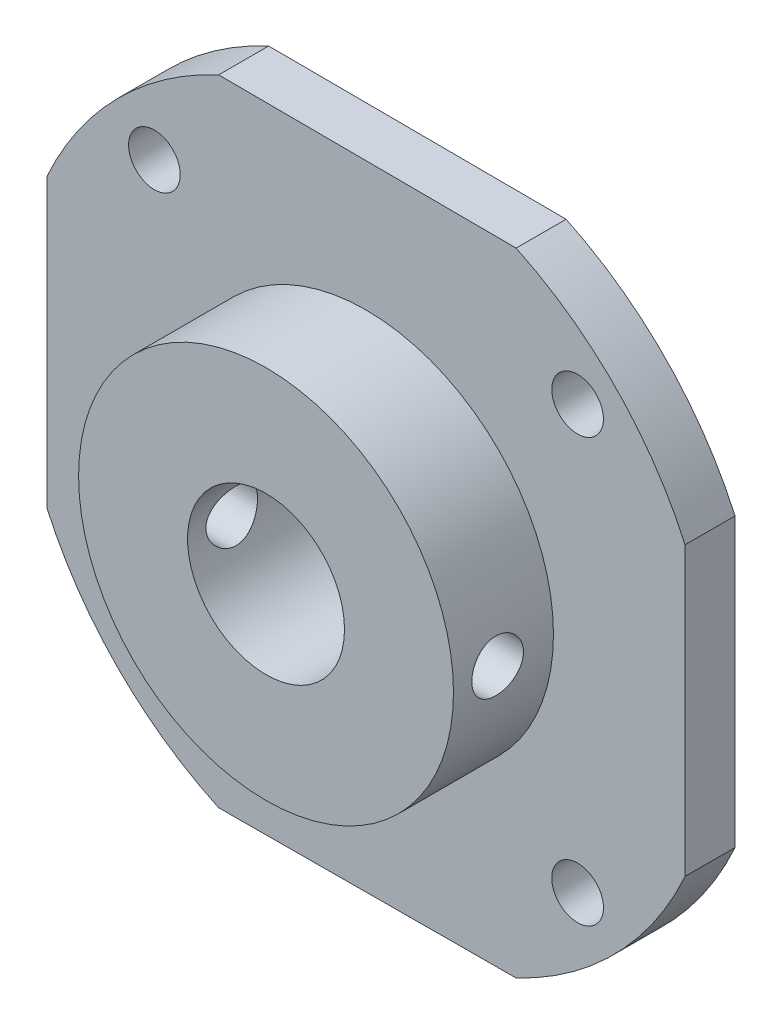
from build123d import *

# Parameters (mm, degrees)
SKETCH1_R          = 21
EXTRUDE1_DEPTH     = 3
SKETCH2_R          = 11.25
EXTRUDE2_DEPTH     = 6
SKETCH3_R          = 1.55
CUT_EXTRUDE1_DEPTH = 44.45
SKETCH4_R          = 1.55
CUT_EXTRUDE2_DEPTH = 62.423132867
SKETCH5_R          = 4.71
CUT_EXTRUDE3_DEPTH = 62.788358531
CUT_EXTRUDE7_DEPTH = 62.788358546


with BuildPart() as part:
    # Sketch1 → Extrude1 (new body)
    with BuildSketch(Plane.XY):
        with Locations((22.225, 22.225)):
            Circle(SKETCH1_R)
    extrude(amount=EXTRUDE1_DEPTH)

    # Sketch2 → Extrude2 (add)
    with BuildSketch(Plane.XY.offset(3)):
        with Locations((22.225, 22.225)):
            Circle(SKETCH2_R)
    extrude(amount=EXTRUDE2_DEPTH)

    # Sketch3 → Cut-Extrude1 (cut)
    with BuildSketch(Plane(origin=(0, 0, 0), x_dir=(0, 0, -1), z_dir=(1, 0, 0))):
        with Locations((-6.35, 22.225)):
            Circle(SKETCH3_R)
    extrude(amount=CUT_EXTRUDE1_DEPTH, mode=Mode.SUBTRACT)

    # Sketch4 → Cut-Extrude2 (cut, through all)
    with BuildSketch(Plane.XY.offset(3)):
        with Locations((34.925, 34.925)):
            Circle(SKETCH4_R)
        with Locations((9.525, 34.925)):
            Circle(SKETCH4_R)
        with Locations((34.925, 9.525)):
            Circle(SKETCH4_R)
        with Locations((9.525, 9.525)):
            Circle(SKETCH4_R)
    extrude(amount=-CUT_EXTRUDE2_DEPTH, mode=Mode.SUBTRACT)

    # Sketch5 → Cut-Extrude3 (cut, through all)
    with BuildSketch(Plane.XY.offset(9)):
        with Locations((22.225, 22.225)):
            Circle(SKETCH5_R)
    extrude(amount=-CUT_EXTRUDE3_DEPTH, mode=Mode.SUBTRACT)

    # Sketch6 → Cut-Extrude7 (cut, through all)
    with BuildSketch(Plane(origin=(0, 0, 0), x_dir=(-1, 0, 0), z_dir=(0, 0, -1))):
        with BuildLine():
            Line((-41.375, 31.75), (-41.375, 12.7))
            ThreePointArc((-41.375, 12.7), (-43.599245228, 22.225), (-41.375, 31.75))
        make_face()
        with BuildLine():
            Line((-3.075, 31.75), (-3.075, 12.7))
            ThreePointArc((-3.075, 12.7), (-0.823008317, 22.225), (-3.075, 31.75))
        make_face()
        with BuildLine():
            Line((-12.7, 41.275), (-31.650699882, 41.192326287))
            ThreePointArc((-31.650699882, 41.192326287), (-22.185081622, 43.464386314), (-12.7, 41.275))
        make_face()
        with BuildLine():
            Line((-12.7, 3.175), (-31.650699882, 3.257673713))
            ThreePointArc((-31.650699882, 3.257673713), (-22.185081622, 0.985613686), (-12.7, 3.175))
        make_face()
    extrude(amount=-CUT_EXTRUDE7_DEPTH, mode=Mode.SUBTRACT)


solid = part.part
